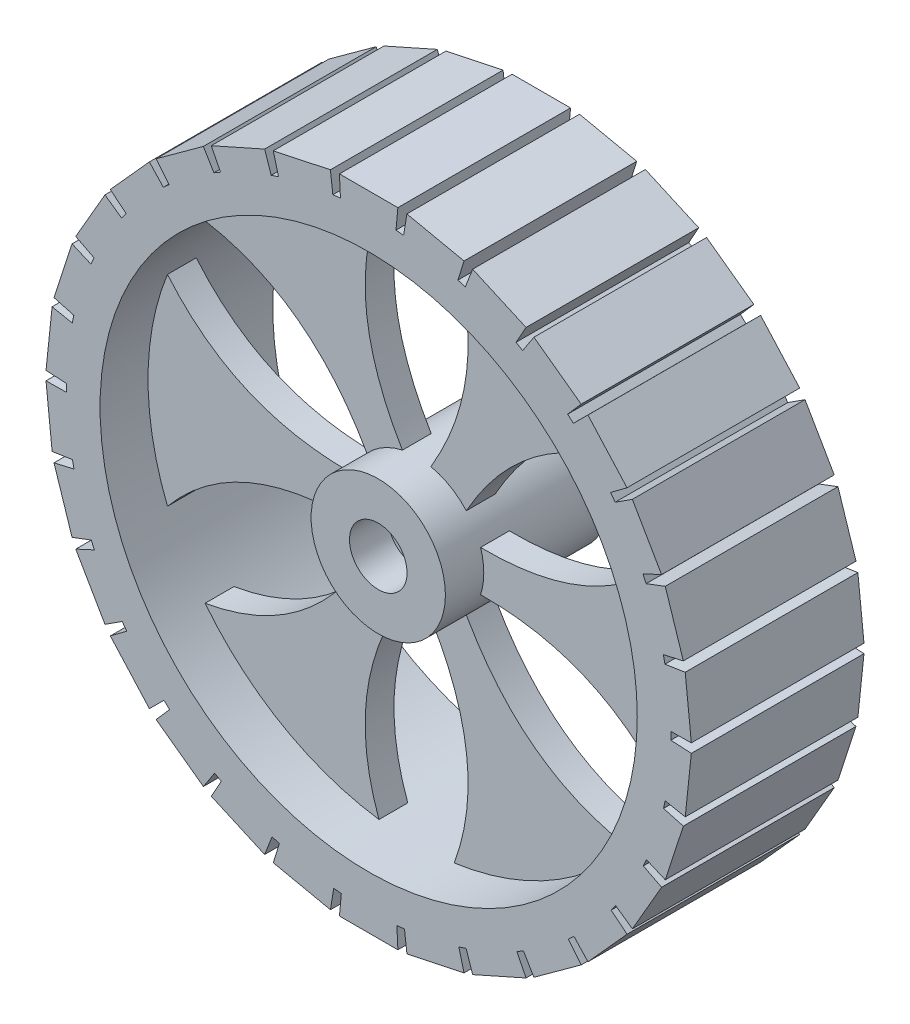
from build123d import *
from build123d.topology import SkipClean

# Parameters (mm, degrees)
SKETCH1_R                 = 28
BOSS_EXTRUDE1_DEPTH       = 18
BOSS_EXTRUDE2_DEPTH       = 18
SKETCH2_R                 = 28
BOSS_EXTRUDE4_DEPTH       = 3
BOSS_EXTRUDE6_DEPTH       = 7
BOSS_EXTRUDE6_DEPTH_BACK  = 10
SKETCH3_R                 = 7
SKETCH3_R_2               = 3
CUT_EXTRUDE5_DEPTH        = 50.21956608
CUT_EXTRUDE5_DEPTH_BACK   = 50.21956608
SKETCH6_R                 = 0.625
F_3_0MM_DOWEL_HOLE1_D     = 3
F_3_0MM_DOWEL_HOLE1_DEPTH = 4
F_3_0MM_DOWEL_HOLE1_TIP   = 0.901290929
CUT_EXTRUDE7_DEPTH        = 49.513561889
CUT_EXTRUDE7_DEPTH_BACK   = 49.513561889
SCALE1_SCALE              = 0.5
SCALE2_SCALE              = 1.25
SCALE3_SCALE              = 1.25
SCALE4_SCALE              = 1.1
SCALE5_SCALE              = 0.8
SCALE6_SCALE              = 1.1


with BuildPart() as part:
    # Sketch1 → Boss-Extrude1 (new body)
    with BuildSketch(Plane.XY):
        with BuildLine():
            ThreePointArc((-2.941780152, 31.362332973), (-3.338490264, 31.322587421), (-3.73466555, 31.277823985))
            ThreePointArc((-3.73466555, 31.277823985), (-6.594303594, 30.802031753), (-9.398090874, 30.065360266))
            ThreePointArc((-9.398090874, 30.065360266), (-9.777868354, 29.944002579), (-10.156079417, 29.817847858))
            ThreePointArc((-10.156079417, 29.817847858), (-12.854304742, 28.757900647), (-15.443659928, 27.454387045))
            ThreePointArc((-15.443659928, 27.454387045), (-15.789906677, 27.256721137), (-16.13362388, 27.054688697))
            ThreePointArc((-16.13362388, 27.054688697), (-18.55251109, 25.456911287), (-20.814266936, 23.64352537))
            ThreePointArc((-20.814266936, 23.64352537), (-21.111850309, 23.378190189), (-21.406051561, 23.109109818))
            ThreePointArc((-21.406051561, 23.109109818), (-23.439883679, 21.043332748), (-25.275190601, 18.799328182))
            ThreePointArc((-25.275190601, 18.799328182), (-25.511104778, 18.477920149), (-25.742932071, 18.15355195))
            ThreePointArc((-25.742932071, 18.15355195), (-27.302820874, 15.71005959), (-28.631467153, 13.133510143))
            ThreePointArc((-28.631467153, 13.133510143), (-28.795401551, 12.770076331), (-28.954722921, 12.404596751))
            ThreePointArc((-28.954722921, 12.404596751), (-29.972493783, 9.690181444), (-30.736411201, 6.893694689))
            ThreePointArc((-30.736411201, 6.893694689), (-30.821201101, 6.5041189), (-30.90105344, 6.11350115))
            ThreePointArc((-30.90105344, 6.11350115), (-31.33222489, 3.246795869), (-31.49802659, 0.352591698))
            ThreePointArc((-31.49802659, 0.352591698), (-31.499966267, -0.046099737), (-31.496859643, -0.444783786))
            ThreePointArc((-31.496859643, -0.444783786), (-31.322587421, -3.338490264), (-30.883027073, -6.203921243))
            ThreePointArc((-30.883027073, -6.203921243), (-30.802031753, -6.594303594), (-30.716101942, -6.983629537))
            ThreePointArc((-30.716101942, -6.983629537), (-29.944002579, -9.777868354), (-28.91829108, -12.489293055))
            ThreePointArc((-28.91829108, -12.489293055), (-28.757900647, -12.854304742), (-28.592903193, -13.217257166))
            ThreePointArc((-28.592903193, -13.217257166), (-27.256721137, -15.789906677), (-25.689687001, -18.228822831))
            ThreePointArc((-25.689687001, -18.228822831), (-25.456911287, -18.55251109), (-25.220057371, -18.873227234))
            ThreePointArc((-25.220057371, -18.873227234), (-23.378190189, -21.111850309), (-21.338320327, -23.171665577))
            ThreePointArc((-21.338320327, -23.171665577), (-21.043332748, -23.439883679), (-20.744974022, -23.704346707))
            ThreePointArc((-20.744974022, -23.704346707), (-18.477920149, -25.511104778), (-16.054366663, -27.101795348))
            ThreePointArc((-16.054366663, -27.101795348), (-15.71005959, -27.302820874), (-15.363235763, -27.499472484))
            ThreePointArc((-15.363235763, -27.499472484), (-12.770076331, -28.795401551), (-10.068760138, -29.847446613))
            ThreePointArc((-10.068760138, -29.847446613), (-9.690181444, -29.972493783), (-9.310050381, -30.092739355))
            ThreePointArc((-9.310050381, -30.092739355), (-6.5041189, -30.821201101), (-3.643100479, -31.288621237))
            ThreePointArc((-3.643100479, -31.288621237), (-3.246795869, -31.33222489), (-2.849971122, -31.370809116))
            ThreePointArc((-2.849971122, -31.370809116), (0.046099737, -31.499966267), (2.941780152, -31.362332973))
            ThreePointArc((2.941780152, -31.362332973), (3.338490264, -31.322587421), (3.73466555, -31.277823985))
            ThreePointArc((3.73466555, -31.277823985), (6.594303594, -30.802031753), (9.398090874, -30.065360266))
            ThreePointArc((9.398090874, -30.065360266), (9.777868354, -29.944002579), (10.156079417, -29.817847858))
            ThreePointArc((10.156079417, -29.817847858), (12.854304742, -28.757900647), (15.443659928, -27.454387045))
            ThreePointArc((15.443659928, -27.454387045), (15.789906677, -27.256721137), (16.13362388, -27.054688697))
            ThreePointArc((16.13362388, -27.054688697), (18.55251109, -25.456911287), (20.814266936, -23.64352537))
            ThreePointArc((20.814266936, -23.64352537), (21.111850309, -23.378190189), (21.406051561, -23.109109818))
            ThreePointArc((21.406051561, -23.109109818), (23.439883679, -21.043332748), (25.275190601, -18.799328182))
            ThreePointArc((25.275190601, -18.799328182), (25.511104778, -18.477920149), (25.742932071, -18.15355195))
            ThreePointArc((25.742932071, -18.15355195), (27.302820874, -15.71005959), (28.631467153, -13.133510143))
            ThreePointArc((28.631467153, -13.133510143), (28.795401551, -12.770076331), (28.954722921, -12.404596751))
            ThreePointArc((28.954722921, -12.404596751), (29.972493783, -9.690181444), (30.736411201, -6.893694689))
            ThreePointArc((30.736411201, -6.893694689), (30.821201101, -6.5041189), (30.90105344, -6.11350115))
            ThreePointArc((30.90105344, -6.11350115), (31.33222489, -3.246795869), (31.49802659, -0.352591698))
            ThreePointArc((31.49802659, -0.352591698), (31.499506644, -0.17629861), (31.5, 0))
            ThreePointArc((31.5, 0), (31.499214901, 0.222397436), (31.496859643, 0.444783786))
            ThreePointArc((31.496859643, 0.444783786), (31.322587421, 3.338490264), (30.883027073, 6.203921243))
            ThreePointArc((30.883027073, 6.203921243), (30.802031753, 6.594303594), (30.716101942, 6.983629537))
            ThreePointArc((30.716101942, 6.983629537), (29.944002579, 9.777868354), (28.91829108, 12.489293055))
            ThreePointArc((28.91829108, 12.489293055), (28.757900647, 12.854304742), (28.592903193, 13.217257166))
            ThreePointArc((28.592903193, 13.217257166), (27.256721137, 15.789906677), (25.689687001, 18.228822831))
            ThreePointArc((25.689687001, 18.228822831), (25.456911287, 18.55251109), (25.220057371, 18.873227234))
            ThreePointArc((25.220057371, 18.873227234), (23.378190189, 21.111850309), (21.338320327, 23.171665577))
            ThreePointArc((21.338320327, 23.171665577), (21.043332748, 23.439883679), (20.744974022, 23.704346707))
            ThreePointArc((20.744974022, 23.704346707), (18.477920149, 25.511104778), (16.054366663, 27.101795348))
            ThreePointArc((16.054366663, 27.101795348), (15.71005959, 27.302820874), (15.363235763, 27.499472484))
            ThreePointArc((15.363235763, 27.499472484), (12.770076331, 28.795401551), (10.068760138, 29.847446613))
            ThreePointArc((10.068760138, 29.847446613), (9.690181444, 29.972493783), (9.310050381, 30.092739355))
            ThreePointArc((9.310050381, 30.092739355), (6.5041189, 30.821201101), (3.643100479, 31.288621237))
            ThreePointArc((3.643100479, 31.288621237), (3.246795869, 31.33222489), (2.849971122, 31.370809116))
            ThreePointArc((2.849971122, 31.370809116), (-0.046099737, 31.499966267), (-2.941780152, 31.362332973))
        make_face()
        Circle(SKETCH1_R, mode=Mode.SUBTRACT)
    extrude(amount=BOSS_EXTRUDE1_DEPTH)

    # Sketch1<5> → Boss-Extrude2 (add)
    with BuildSketch(Plane.XY):
        with BuildLine():
            ThreePointArc((-2.941780152, 31.362332973), (-0.046099737, 31.499966267), (2.849971122, 31.370809116))
            Line((2.849971122, 31.370809116), (3.043403574, 33.5))
            Line((3.043403574, 33.5), (-3.047524724, 33.5))
            Line((-3.047524724, 33.5), (-2.941780152, 31.362332973))
        make_face()
        with BuildLine():
            Line((3.984112645, 33.401560643), (3.643100479, 31.288621237))
            ThreePointArc((3.643100479, 31.288621237), (6.5041189, 30.821201101), (9.310050381, 30.092739355))
            Line((9.310050381, 30.092739355), (9.941939547, 32.135185442))
            Line((9.941939547, 32.135185442), (3.984112645, 33.401560643))
        make_face()
        with BuildLine():
            ThreePointArc((-9.398090874, 30.065360266), (-6.594303594, 30.802031753), (-3.73466555, 31.277823985))
            Line((-3.73466555, 31.277823985), (-3.988143738, 33.400703808))
            Line((-3.988143738, 33.400703808), (-9.94597064, 32.134328606))
            Line((-9.94597064, 32.134328606), (-9.398090874, 30.065360266))
        make_face()
        with BuildLine():
            Line((10.841625174, 31.843312807), (10.068760138, 29.847446613))
            ThreePointArc((10.068760138, 29.847446613), (12.770076331, 28.795401551), (15.363235763, 27.499472484))
            Line((15.363235763, 27.499472484), (16.405965054, 29.365909078))
            Line((16.405965054, 29.365909078), (10.841625174, 31.843312807))
        make_face()
        with BuildLine():
            ThreePointArc((-15.443659928, 27.454387045), (-12.854304742, 28.757900647), (-10.156079417, 29.817847858))
            Line((-10.156079417, 29.817847858), (-10.845390032, 31.841636584))
            Line((-10.845390032, 31.841636584), (-16.409729912, 29.364232855))
            Line((-16.409729912, 29.364232855), (-15.443659928, 27.454387045))
        make_face()
        with BuildLine():
            Line((17.225306659, 28.893359401), (16.054366663, 27.101795348))
            ThreePointArc((16.054366663, 27.101795348), (18.477920149, 25.511104778), (20.744974022, 23.704346707))
            Line((20.744974022, 23.704346707), (22.152971164, 25.313201574))
            Line((22.152971164, 25.313201574), (17.225306659, 28.893359401))
        make_face()
        with BuildLine():
            ThreePointArc((-20.814266936, 23.64352537), (-18.55251109, 25.456911287), (-16.13362388, 27.054688697))
            Line((-16.13362388, 27.054688697), (-17.22864074, 28.890937049))
            Line((-17.22864074, 28.890937049), (-22.156305245, 25.310779223))
            Line((-22.156305245, 25.310779223), (-20.814266936, 23.64352537))
        make_face()
        with BuildLine():
            Line((22.856159587, 24.680627542), (21.338320327, 23.171665577))
            ThreePointArc((21.338320327, 23.171665577), (23.378190189, 21.111850309), (25.220057371, 18.873227234))
            Line((25.220057371, 18.873227234), (26.931786133, 20.154185695))
            Line((26.931786133, 20.154185695), (22.856159587, 24.680627542))
        make_face()
        with BuildLine():
            ThreePointArc((-25.275190601, 18.799328182), (-23.439883679, 21.043332748), (-21.406051561, 23.109109818))
            Line((-21.406051561, 23.109109818), (-22.858917174, 24.677564931))
            Line((-22.858917174, 24.677564931), (-26.93454372, 20.151123084))
            Line((-26.93454372, 20.151123084), (-25.275190601, 18.799328182))
        make_face()
        with BuildLine():
            Line((27.488088665, 19.38923383), (25.689687001, 18.228822831))
            ThreePointArc((25.689687001, 18.228822831), (27.256721137, 15.789906677), (28.592903193, 13.217257166))
            Line((28.592903193, 13.217257166), (30.533552814, 14.114335191))
            Line((30.533552814, 14.114335191), (27.488088665, 19.38923383))
        make_face()
        with BuildLine():
            ThreePointArc((-28.631467153, 13.133510143), (-27.302820874, 15.71005959), (-25.742932071, 18.15355195))
            Line((-25.742932071, 18.15355195), (-27.49014924, 19.385664809))
            Line((-27.49014924, 19.385664809), (-30.535613389, 14.11076617))
            Line((-30.535613389, 14.11076617), (-28.631467153, 13.133510143))
        make_face()
        with BuildLine():
            Line((30.918656365, 13.250437559), (28.91829108, 12.489293055))
            ThreePointArc((28.91829108, 12.489293055), (29.944002579, 9.777868354), (30.716101942, 6.983629537))
            Line((30.716101942, 6.983629537), (32.800856721, 7.457620511))
            Line((32.800856721, 7.457620511), (30.918656365, 13.250437559))
        make_face()
        with BuildLine():
            ThreePointArc((-30.736411201, 6.893694689), (-29.972493783, 9.690181444), (-28.954722921, 12.404596751))
            Line((-28.954722921, 12.404596751), (-30.919929871, 13.246518113))
            Line((-30.919929871, 13.246518113), (-32.802130227, 7.453701064))
            Line((-32.802130227, 7.453701064), (-30.736411201, 6.893694689))
        make_face()
        with BuildLine():
            Line((32.997930419, 6.532533585), (30.883027073, 6.203921243))
            ThreePointArc((30.883027073, 6.203921243), (31.322587421, 3.338490264), (31.496859643, 0.444783786))
            Line((31.496859643, 0.444783786), (33.634605794, 0.474972028))
            Line((33.634605794, 0.474972028), (32.997930419, 6.532533585))
        make_face()
        with BuildLine():
            ThreePointArc((-31.49802659, 0.352591698), (-31.33222489, 3.246795869), (-30.90105344, 6.11350115))
            Line((-30.90105344, 6.11350115), (-32.998361196, 6.52843501))
            Line((-32.998361196, 6.52843501), (-33.635036571, 0.470873454))
            Line((-33.635036571, 0.470873454), (-31.49802659, 0.352591698))
        make_face()
        with BuildLine():
            ThreePointArc((-30.883027073, -6.203921243), (-31.322587421, -3.338490264), (-31.496859643, -0.444783786))
            Line((-31.496859643, -0.444783786), (-33.634605794, -0.474972028))
            Line((-33.634605794, -0.474972028), (-32.997930419, -6.532533585))
            Line((-32.997930419, -6.532533585), (-30.883027073, -6.203921243))
        make_face()
        with BuildLine():
            Line((33.635036571, -0.470873454), (31.49802659, -0.352591698))
            ThreePointArc((31.49802659, -0.352591698), (31.33222489, -3.246795869), (30.90105344, -6.11350115))
            Line((30.90105344, -6.11350115), (32.998361196, -6.52843501))
            Line((32.998361196, -6.52843501), (33.635036571, -0.470873454))
        make_face()
        with BuildLine():
            ThreePointArc((-28.91829108, -12.489293055), (-29.944002579, -9.777868354), (-30.716101942, -6.983629537))
            Line((-30.716101942, -6.983629537), (-32.800856721, -7.457620511))
            Line((-32.800856721, -7.457620511), (-30.918656365, -13.250437559))
            Line((-30.918656365, -13.250437559), (-28.91829108, -12.489293055))
        make_face()
        with BuildLine():
            Line((32.802130227, -7.453701064), (30.736411201, -6.893694689))
            ThreePointArc((30.736411201, -6.893694689), (29.972493783, -9.690181444), (28.954722921, -12.404596751))
            Line((28.954722921, -12.404596751), (30.919929871, -13.246518113))
            Line((30.919929871, -13.246518113), (32.802130227, -7.453701064))
        make_face()
        with BuildLine():
            ThreePointArc((-25.689687001, -18.228822831), (-27.256721137, -15.789906677), (-28.592903193, -13.217257166))
            Line((-28.592903193, -13.217257166), (-30.533552814, -14.114335191))
            Line((-30.533552814, -14.114335191), (-27.488088665, -19.38923383))
            Line((-27.488088665, -19.38923383), (-25.689687001, -18.228822831))
        make_face()
        with BuildLine():
            Line((30.535613389, -14.11076617), (28.631467153, -13.133510143))
            ThreePointArc((28.631467153, -13.133510143), (27.302820874, -15.71005959), (25.742932071, -18.15355195))
            Line((25.742932071, -18.15355195), (27.49014924, -19.385664809))
            Line((27.49014924, -19.385664809), (30.535613389, -14.11076617))
        make_face()
        with BuildLine():
            ThreePointArc((-21.338320327, -23.171665577), (-23.378190189, -21.111850309), (-25.220057371, -18.873227234))
            Line((-25.220057371, -18.873227234), (-26.931786132, -20.154185695))
            Line((-26.931786132, -20.154185695), (-22.856159587, -24.680627542))
            Line((-22.856159587, -24.680627542), (-21.338320327, -23.171665577))
        make_face()
        with BuildLine():
            Line((26.93454372, -20.151123084), (25.275190601, -18.799328182))
            ThreePointArc((25.275190601, -18.799328182), (23.439883679, -21.043332748), (21.406051561, -23.109109818))
            Line((21.406051561, -23.109109818), (22.858917174, -24.677564931))
            Line((22.858917174, -24.677564931), (26.93454372, -20.151123084))
        make_face()
        with BuildLine():
            ThreePointArc((-16.054366663, -27.101795348), (-18.477920149, -25.511104778), (-20.744974022, -23.704346707))
            Line((-20.744974022, -23.704346707), (-22.152971164, -25.313201574))
            Line((-22.152971164, -25.313201574), (-17.225306659, -28.893359401))
            Line((-17.225306659, -28.893359401), (-16.054366663, -27.101795348))
        make_face()
        with BuildLine():
            Line((22.156305245, -25.310779223), (20.814266936, -23.64352537))
            ThreePointArc((20.814266936, -23.64352537), (18.55251109, -25.456911287), (16.13362388, -27.054688697))
            Line((16.13362388, -27.054688697), (17.22864074, -28.890937049))
            Line((17.22864074, -28.890937049), (22.156305245, -25.310779223))
        make_face()
        with BuildLine():
            ThreePointArc((-10.068760138, -29.847446613), (-12.770076331, -28.795401551), (-15.363235763, -27.499472484))
            Line((-15.363235763, -27.499472484), (-16.405965054, -29.365909078))
            Line((-16.405965054, -29.365909078), (-10.841625174, -31.843312807))
            Line((-10.841625174, -31.843312807), (-10.068760138, -29.847446613))
        make_face()
        with BuildLine():
            Line((16.409729912, -29.364232855), (15.443659928, -27.454387045))
            ThreePointArc((15.443659928, -27.454387045), (12.854304742, -28.757900647), (10.156079417, -29.817847858))
            Line((10.156079417, -29.817847858), (10.845390032, -31.841636584))
            Line((10.845390032, -31.841636584), (16.409729912, -29.364232855))
        make_face()
        with BuildLine():
            ThreePointArc((-3.643100479, -31.288621237), (-6.5041189, -30.821201101), (-9.310050381, -30.092739355))
            Line((-9.310050381, -30.092739355), (-9.941939547, -32.135185442))
            Line((-9.941939547, -32.135185442), (-3.984112645, -33.401560643))
            Line((-3.984112645, -33.401560643), (-3.643100479, -31.288621237))
        make_face()
        with BuildLine():
            Line((9.94597064, -32.134328606), (9.398090874, -30.065360266))
            ThreePointArc((9.398090874, -30.065360266), (6.594303594, -30.802031753), (3.73466555, -31.277823985))
            Line((3.73466555, -31.277823985), (3.988143738, -33.400703808))
            Line((3.988143738, -33.400703808), (9.94597064, -32.134328606))
        make_face()
        with BuildLine():
            ThreePointArc((2.941780152, -31.362332973), (0.046099737, -31.499966267), (-2.849971122, -31.370809116))
            Line((-2.849971122, -31.370809116), (-3.043403574, -33.5))
            Line((-3.043403574, -33.5), (3.047524724, -33.5))
            Line((3.047524724, -33.5), (2.941780152, -31.362332973))
        make_face()
    extrude(amount=BOSS_EXTRUDE2_DEPTH)

    # Sketch2 → Boss-Extrude4 (add)
    with BuildSketch(Plane.XY.offset(10)):
        Circle(SKETCH2_R)
    extrude(amount=BOSS_EXTRUDE4_DEPTH)

    # Sketch3 → Boss-Extrude6 (add, two sides: drawn at the far end of the back side and taken through both)
    with BuildSketch(Plane.XY.offset(10).offset(-BOSS_EXTRUDE6_DEPTH_BACK)):
        Circle(SKETCH3_R)
        Circle(SKETCH3_R_2, mode=Mode.SUBTRACT)
    extrude(amount=BOSS_EXTRUDE6_DEPTH + BOSS_EXTRUDE6_DEPTH_BACK)

    # Sketch6 → Cut-Extrude5 (cut, two sides: drawn at the far end of the back side and taken through both)
    with BuildSketch(Plane.XY.offset(13).offset(-CUT_EXTRUDE5_DEPTH_BACK)):
        Circle(SKETCH6_R)
    extrude(amount=CUT_EXTRUDE5_DEPTH + CUT_EXTRUDE5_DEPTH_BACK, mode=Mode.SUBTRACT)

    # Ø3.0mm Dowel Hole1
    with Locations(Plane(origin=(-6.997648189, -0.181438196, 5.530496733), x_dir=(0.02591974233, -0.99966402704, 0), z_dir=(-0.99966402704, -0.02591974233, 0))):
        with Locations((0, 0)):
            Hole(F_3_0MM_DOWEL_HOLE1_D / 2, depth=F_3_0MM_DOWEL_HOLE1_DEPTH)
            with Locations((0, 0, -(F_3_0MM_DOWEL_HOLE1_DEPTH + F_3_0MM_DOWEL_HOLE1_TIP / 2))):  # 118° drill point
                Cone(0, F_3_0MM_DOWEL_HOLE1_D / 2, F_3_0MM_DOWEL_HOLE1_TIP, mode=Mode.SUBTRACT)

    # Sketch12 → Cut-Extrude7 (cut, two sides: drawn at the far end of the back side and taken through both)
    with SkipClean():  # the faces are left unmerged after this step: merging them gives an invalid solid
        with BuildSketch(Plane.XY.offset(10).offset(-CUT_EXTRUDE7_DEPTH_BACK)):
            with BuildLine():
                ThreePointArc((3.923655675, 27.723724969), (0, 28), (-3.923655675, 27.723724969))
                add(Edge.make_bspline(
                    [(-1.484805877, 6.840712792), (-7.729705172, 17.351530154), (-3.923655675, 27.723724969)],
                    knots=[0, 0, 0, 1, 1, 1], degree=2))
                ThreePointArc((-1.484805877, 6.840712792), (0, 7), (1.484805877, 6.840712792))
                add(Edge.make_bspline(
                    [(1.484805877, 6.840712792), (7.729705172, 17.351530154), (3.923655675, 27.723724969)],
                    knots=[0, 0, 0, 1, 1, 1], degree=2))
            make_face()
            with BuildLine():
                ThreePointArc((1.484805877, -6.840712792), (0, -7), (-1.484805877, -6.840712792))
                add(Edge.make_bspline(
                    [(-1.484805877, -6.840712792), (-7.729705172, -17.351530154), (-3.923655675, -27.723724969)],
                    knots=[0, 0, 0, 1, 1, 1], degree=2))
                ThreePointArc((-3.923655675, -27.723724969), (0, -28), (3.923655675, -27.723724969))
                add(Edge.make_bspline(
                    [(1.484805877, -6.840712792), (7.729705172, -17.351530154), (3.923655675, -27.723724969)],
                    knots=[0, 0, 0, 1, 1, 1], degree=2))
            make_face()
            with BuildLine():
                ThreePointArc((25.971277948, 10.463876994), (24.248711306, 14), (22.047622273, 17.259847975))
                add(Edge.make_bspline(
                    [(5.181828119, 4.706236006), (11.162013322, 15.36988612), (22.047622273, 17.259847975)],
                    knots=[0, 0, 0, 1, 1, 1], degree=2))
                ThreePointArc((5.181828119, 4.706236006), (6.062177826, 3.5), (6.666633997, 2.134476787))
                add(Edge.make_bspline(
                    [(6.666633997, 2.134476787), (18.891718494, 1.981644034), (25.971277948, 10.463876994)],
                    knots=[0, 0, 0, 1, 1, 1], degree=2))
            make_face()
            with BuildLine():
                add(Edge.make_bspline(
                    [(-5.181828119, 4.706236006), (-11.162013322, 15.36988612), (-22.047622273, 17.259847975)],
                    knots=[0, 0, 0, 1, 1, 1], degree=2))
                ThreePointArc((-22.047622273, 17.259847975), (-24.248711306, 14), (-25.971277948, 10.463876994))
                add(Edge.make_bspline(
                    [(-6.666633997, 2.134476787), (-18.891718494, 1.981644034), (-25.971277948, 10.463876994)],
                    knots=[0, 0, 0, 1, 1, 1], degree=2))
                ThreePointArc((-6.666633997, 2.134476787), (-6.062177826, 3.5), (-5.181828119, 4.706236006))
            make_face()
            with BuildLine():
                add(Edge.make_bspline(
                    [(-5.181828119, -4.706236006), (-11.162013322, -15.36988612), (-22.047622273, -17.259847975)],
                    knots=[0, 0, 0, 1, 1, 1], degree=2))
                ThreePointArc((-5.181828119, -4.706236006), (-6.062177826, -3.5), (-6.666633997, -2.134476787))
                add(Edge.make_bspline(
                    [(-6.666633997, -2.134476787), (-18.891718494, -1.981644034), (-25.971277948, -10.463876994)],
                    knots=[0, 0, 0, 1, 1, 1], degree=2))
                ThreePointArc((-25.971277948, -10.463876994), (-24.248711306, -14), (-22.047622273, -17.259847975))
            make_face()
            with BuildLine():
                ThreePointArc((6.666633997, -2.134476787), (6.062177826, -3.5), (5.181828119, -4.706236006))
                add(Edge.make_bspline(
                    [(5.181828119, -4.706236006), (11.162013322, -15.36988612), (22.047622273, -17.259847975)],
                    knots=[0, 0, 0, 1, 1, 1], degree=2))
                ThreePointArc((22.047622273, -17.259847975), (24.248711306, -14), (25.971277948, -10.463876994))
                add(Edge.make_bspline(
                    [(6.666633997, -2.134476787), (18.891718494, -1.981644034), (25.971277948, -10.463876994)],
                    knots=[0, 0, 0, 1, 1, 1], degree=2))
            make_face()
        extrude(amount=CUT_EXTRUDE7_DEPTH + CUT_EXTRUDE7_DEPTH_BACK, mode=Mode.SUBTRACT)


with BuildPart() as part_1:
    # Scale1: scaled about (0.005822619, 0.00015098, 9.342659719)
    add(part.part.scale(SCALE1_SCALE).moved(Location((0.00291131, 7.549e-05, 4.67132986))))


with BuildPart() as part_2:
    # Scale2: scaled about (0.005822619, 0.00015098, 9.342659719)
    add(part_1.part.scale(SCALE2_SCALE).moved(Location((-0.001455655, -3.7745e-05, -2.33566493))))


with BuildPart() as part_3:
    # Scale3: scaled about (0.005822619, 0.00015098, 9.342659719)
    add(part_2.part.scale(SCALE3_SCALE).moved(Location((-0.001455655, -3.7745e-05, -2.33566493))))


with BuildPart() as part_4:
    # Scale4: scaled about (0.005822619, 0.00015098, 9.342659719)
    add(part_3.part.scale(SCALE4_SCALE).moved(Location((-0.000582262, -1.5098e-05, -0.934265972))))


with BuildPart() as part_5:
    # Scale5: scaled about (0.005822619, 0.00015098, 9.342659719)
    add(part_4.part.scale(SCALE5_SCALE).moved(Location((0.001164524, 3.0196e-05, 1.868531944))))


with BuildPart() as part_6:
    # Scale6: scaled about (0.005822619, 0.00015098, 9.342659719)
    add(part_5.part.scale(SCALE6_SCALE).moved(Location((-0.000582262, -1.5098e-05, -0.934265972))))


solid = part_6.part
